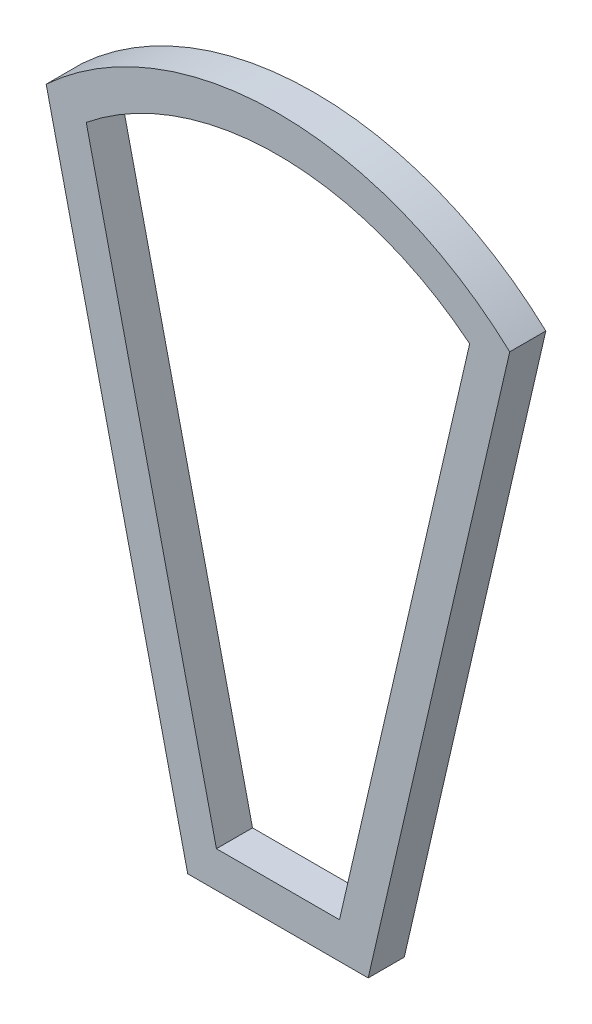
from build123d import *

# Parameters (mm, degrees)
BOSS_EXTRUDE1_DEPTH = 0.2


with BuildPart() as part:
    # Sketch1 → Boss-Extrude1 (new body)
    with BuildSketch(Plane.XY):
        with BuildLine():
            Line((-0.5, -1.7), (-1.284273133, 1.697060155))
            ThreePointArc((-1.284273133, 1.697060155), (0, 2.2), (1.284273133, 1.697060155))
            Line((1.284273133, 1.697060155), (0.5, -1.7))
            Line((0.5, -1.7), (-0.5, -1.7))
        make_face()
        with BuildLine():
            Line((-0.340912817, -1.5), (-1.062311014, 1.624718889))
            ThreePointArc((-1.062311014, 1.624718889), (0, 2), (1.062311014, 1.624718889))
            Line((1.062311014, 1.624718889), (0.340912817, -1.5))
            Line((0.340912817, -1.5), (-0.340912817, -1.5))
        make_face(mode=Mode.SUBTRACT)
    extrude(amount=BOSS_EXTRUDE1_DEPTH)


solid = part.part
